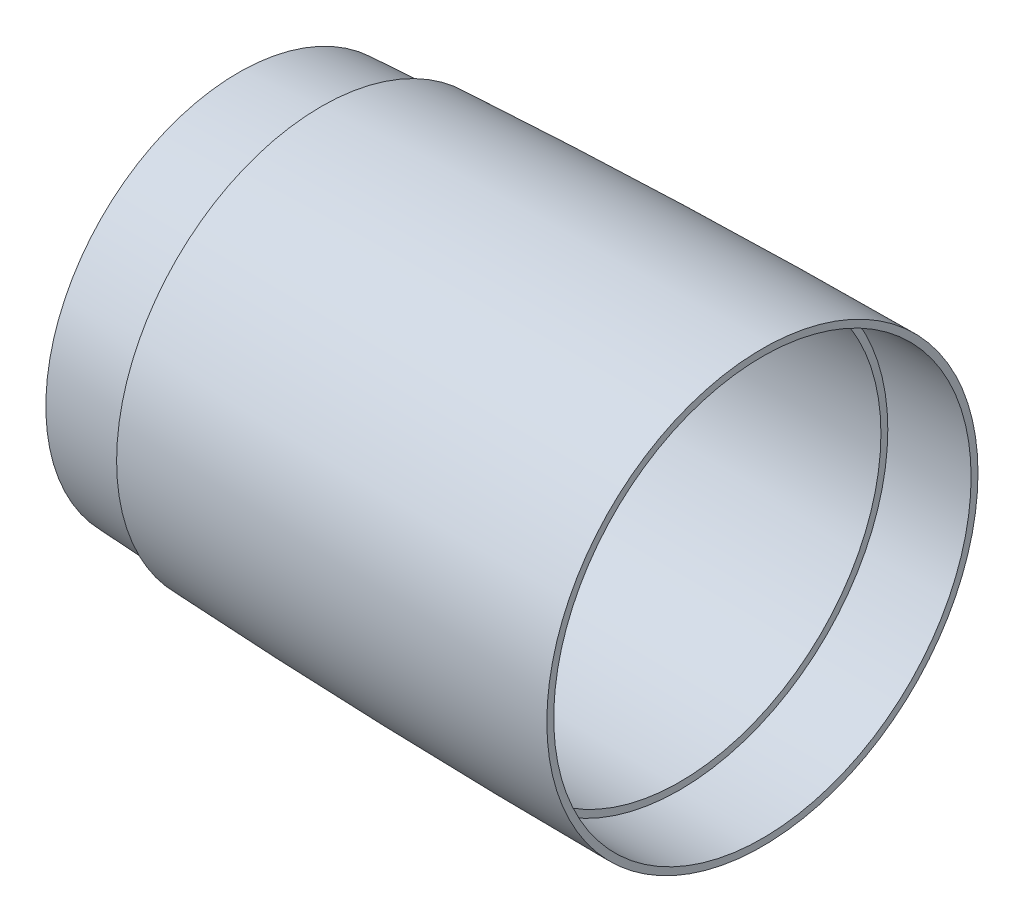
from build123d import *


with BuildPart() as part:
    # Sketch1 → Revolve1 (revolve)
    with BuildSketch(Plane.XY):
        with BuildLine():
            Line((-10, 3632.986237243), (-10, 3635.486246708))
            ThreePointArc((-10, 3635.486246708), (-90.021811645, 3634.38527449), (-170, 3631.523130864))
            Line((-170, 3631.523130864), (-170, 3629.020391235))
            Line((-170, 3629.020391235), (-170, 3628.720062226))
            ThreePointArc((-170, 3628.720062226), (-185.001581242, 3627.986177611), (-200, 3627.190274855))
            Line((-200, 3627.190274855), (-200, 3624.986931011))
            ThreePointArc((-200, 3624.986931011), (-120.029176398, 3628.515295105), (-40, 3630.279637989))
            Line((-40, 3630.279637989), (-40, 3632.479771451))
            Line((-40, 3632.479771451), (-40, 3632.779789638))
            ThreePointArc((-40, 3632.779789638), (-25.000213102, 3632.913980449), (-10, 3632.986237243))
        make_face()
    revolve(axis=Axis((0, 3557.296761587, 0), (-1, 0, 0)))


solid = part.part
